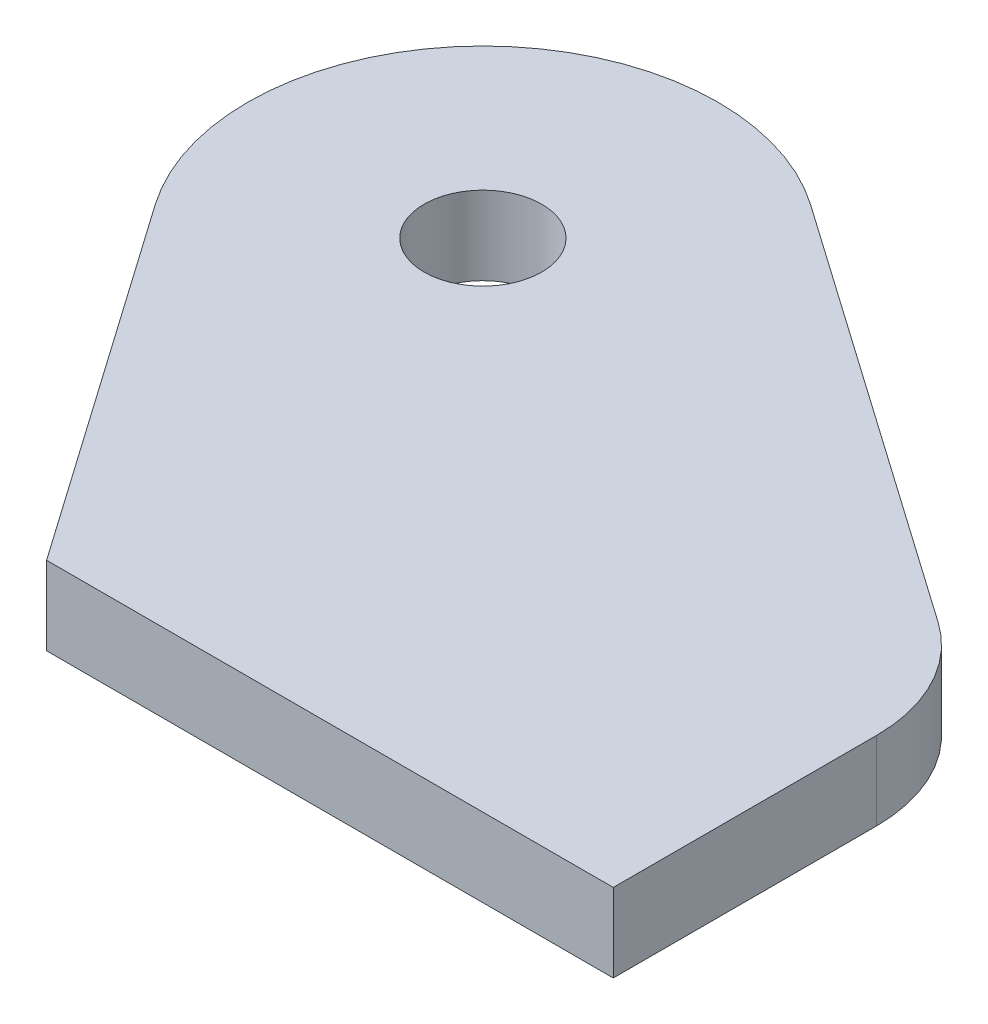
from build123d import *

# Parameters (mm, degrees)
SKETCH1_R           = 4.7625
BOSS_EXTRUDE1_DEPTH = 6.35


with BuildPart() as part:
    # Sketch1 → Boss-Extrude1 (new body)
    with BuildSketch(Plane(origin=(0, 0, 0), x_dir=(1, 0, 0), z_dir=(0, 1, 0))):
        with BuildLine():
            ThreePointArc((29.976631112, 55.849090528), (5.579615818, 53.714628266), (3.445153556, 29.317612972))
            Line((3.445153556, 29.317612972), (23.973567161, 0))
            Line((23.973567161, 0), (69.85, 0))
            Line((69.85, 0), (69.85, 21.318255517))
            ThreePointArc((69.85, 21.318255517), (68.415037581, 27.182462905), (64.434420742, 31.721486479))
            Line((64.434420742, 31.721486479), (29.976631112, 55.849090528))
        make_face()
        with Locations((19.05, 40.244244084)):
            Circle(SKETCH1_R, mode=Mode.SUBTRACT)
    extrude(amount=BOSS_EXTRUDE1_DEPTH)


solid = part.part
